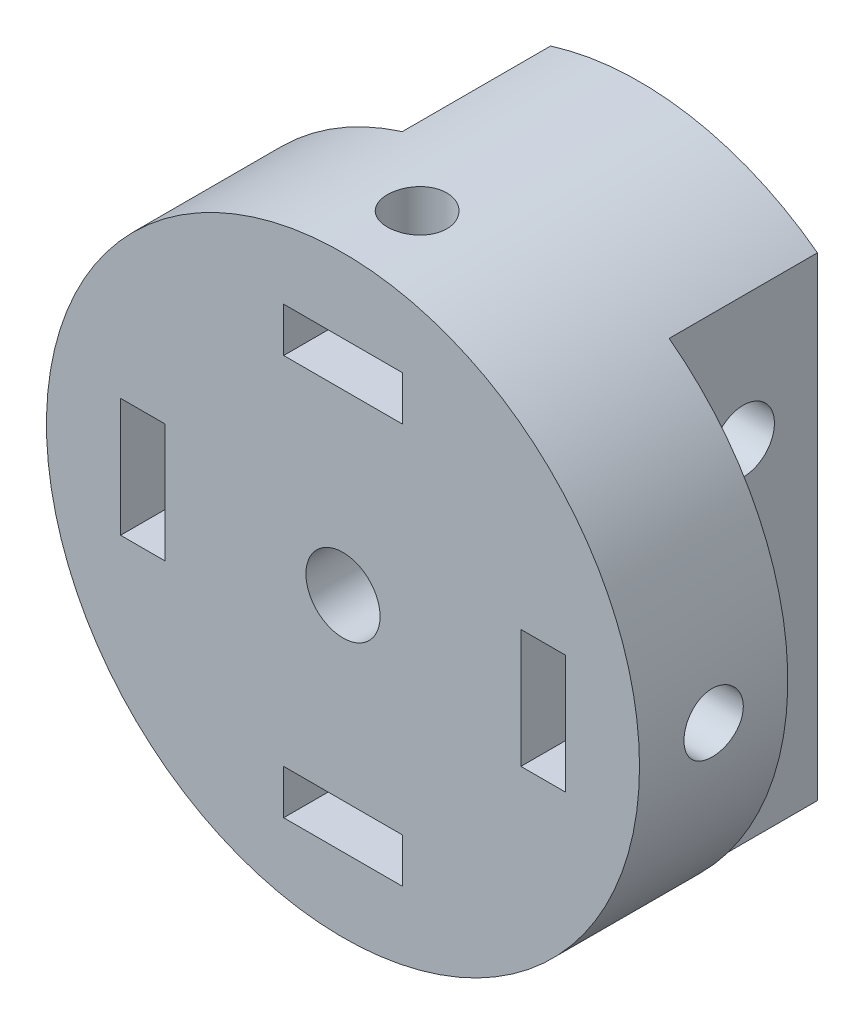
from build123d import *

# Parameters (mm, degrees)
SKETCH3_R                    = 25.4
SKETCH3_R_2                  = 3.175
BASE_DEPTH                   = 12.7
UPPER_BOLTS_CONNECTION_START = 12.7
SKETCH6_R                    = 3.175
UPPER_BOLTS_CONNECTION_DEPTH = 12.7
NUT_HOLE_DEPTH               = 8.89
UPPER_BOLTHOLES_REACH        = 45.552
SKETCH9_R                    = 2.667
NUT_RECESS_START             = -6.35
NUT_RECESS_DEPTH             = 3.81
SKETCH14_R                   = 2.54
RADIAL_BOLT_HOLE_DEPTH       = 15.24
CIRPATTERN2_COUNT            = 4


with BuildPart() as part:
    # Sketch3 → base (new body)
    with BuildSketch(Plane(origin=(0, 0, 0), x_dir=(0, 1, 0), z_dir=(0, 0, 1))):
        Circle(SKETCH3_R)
        Circle(SKETCH3_R_2, mode=Mode.SUBTRACT)
    extrude(amount=BASE_DEPTH)

    # Sketch6 → upper_bolts_connection (add)
    with BuildSketch(Plane(origin=(0, 0, 0), x_dir=(1, 0, 0), z_dir=(0, 0, -1)).offset(UPPER_BOLTS_CONNECTION_START)):
        with BuildLine():
            Line((15.24, 20.32), (15.24, -20.32))
            ThreePointArc((15.24, -20.32), (4.282316421, -25.036408809), (-7.62, -24.230055716))
            Line((-7.62, -24.230055716), (-7.62, 24.230055716))
            ThreePointArc((-7.62, 24.230055716), (4.282316421, 25.036408809), (15.24, 20.32))
        make_face()
        Circle(SKETCH6_R, mode=Mode.SUBTRACT)
    extrude(amount=-UPPER_BOLTS_CONNECTION_DEPTH)

    # Sketch8 → nut_hole (cut)
    with BuildSketch(Plane(origin=(0, 0, -12.7), x_dir=(1, 0, 0), z_dir=(0, 0, -1))):
        Polygon((6.599113577, 0), (3.299556788, 5.715), (-3.299556788, 5.715), (-6.599113577, 0), (-3.299556788, -5.715), (3.299556788, -5.715), align=None)
    extrude(amount=-NUT_HOLE_DEPTH, mode=Mode.SUBTRACT)

    # Sketch9 → upper_boltholes (cut, up to next)
    with BuildSketch(Plane.ZY.offset(7.62), mode=Mode.PRIVATE) as upper_boltholes_sk1:
        with Locations((-6.35, -9.525)):
            Circle(SKETCH9_R)
    upper_boltholes_tool1 = extrude(upper_boltholes_sk1.sketch, amount=-UPPER_BOLTHOLES_REACH, mode=Mode.PRIVATE) & part.part
    # Sketch9 → upper_boltholes (cut, up to next)
    with BuildSketch(Plane.ZY.offset(7.62), mode=Mode.PRIVATE) as upper_boltholes_sk2:
        with Locations((-6.35, 9.525)):
            Circle(SKETCH9_R)
    upper_boltholes_tool2 = extrude(upper_boltholes_sk2.sketch, amount=-UPPER_BOLTHOLES_REACH, mode=Mode.PRIVATE) & part.part
    add(upper_boltholes_tool1.solids().sort_by_distance((-7.62, -9.525, -6.35))[0], mode=Mode.SUBTRACT)
    add(upper_boltholes_tool2.solids().sort_by_distance((-7.62, 9.525, -6.35))[0], mode=Mode.SUBTRACT)

    # Sketch13 → nut_recess (cut)
    with BuildSketch(Plane.ZY.offset(25.4).offset(NUT_RECESS_START)):
        Polygon((3.417060633, 5.08), (0.484121265, 0), (3.417060633, -5.08), (12.7, -5.08), (12.7, 5.08), align=None)
    nut_recess = extrude(amount=-NUT_RECESS_DEPTH, mode=Mode.SUBTRACT)

    # Sketch14 → radial_bolt_hole (cut)
    with BuildSketch(Plane.ZY.offset(25.4)):
        with Locations((6.35, 0)):
            Circle(SKETCH14_R)
    radial_bolt_hole = extrude(amount=-RADIAL_BOLT_HOLE_DEPTH, mode=Mode.SUBTRACT)

    # CirPattern2: nut_recess, radial_bolt_hole ×4 about axis
    cirpattern2_axis = Axis((0, 0, 12.7), (0, 0, -1))
    add([nut_recess.rotate(cirpattern2_axis, i * 360 / CIRPATTERN2_COUNT) for i in range(1, CIRPATTERN2_COUNT)], mode=Mode.SUBTRACT)
    add([radial_bolt_hole.rotate(cirpattern2_axis, i * 360 / CIRPATTERN2_COUNT) for i in range(1, CIRPATTERN2_COUNT)], mode=Mode.SUBTRACT)


solid = part.part
